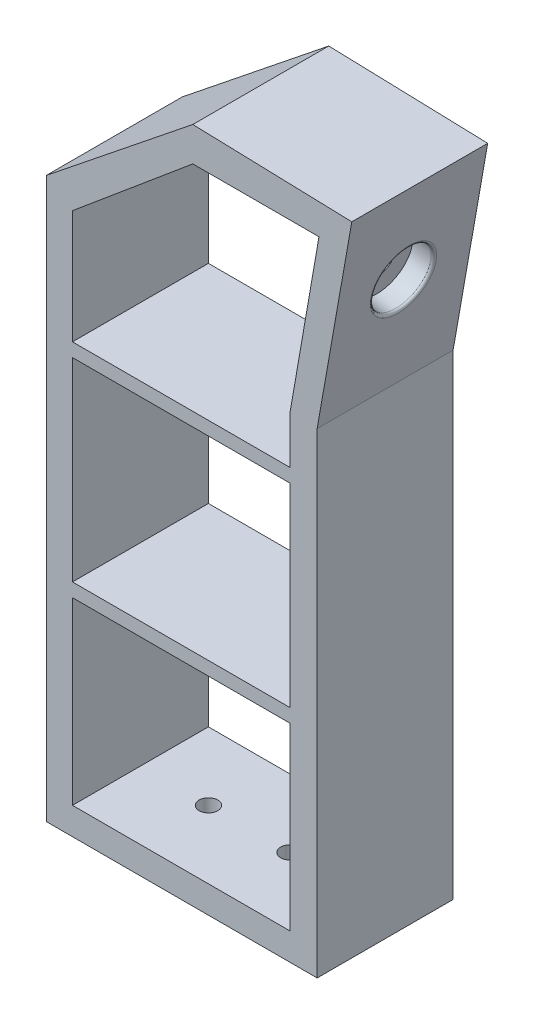
from build123d import *

# Parameters (mm, degrees)
BOSS_EXTRUDE1_DEPTH = 50
SKETCH10_R          = 3.425
CUT_EXTRUDE5_DEPTH  = 10
SKETCH11_W          = 80
SKETCH11_H          = 5
BOSS_EXTRUDE3_DEPTH = 50
SKETCH14_R          = 11.025
CUT_EXTRUDE6_DEPTH  = 8
SKETCH15_R          = 4.05
CUT_EXTRUDE7_DEPTH  = 3
FILLET1_R           = 1


with BuildPart() as part:
    # Sketch2 → Boss-Extrude1 (new body)
    with BuildSketch(Plane.XY):
        Polygon((-40.506485759, 0), (59.130974018, 0), (59.130974018, 175), (71.870010435, 247.246665631), (13.397315769, 249.004598584), (-40.506485759, 205.829132158), align=None)
        Polygon((59.130974018, 232.587704831), (59.8009874, 236.446158122), (42.633663102, 236.446158122), (13.397315769, 236.446158122), (6.25157797, 230.468732297), (-30.869025982, 199.417263157), (-30.869025982, 107.989726368), (-30.869025982, 10), (0, 10), (49.130974018, 10), (49.130974018, 87.5), (49.130974018, 175), align=None, mode=Mode.SUBTRACT)
    extrude(amount=BOSS_EXTRUDE1_DEPTH)

    # Sketch10 → Cut-Extrude5 (cut)
    with BuildSketch(Plane(origin=(0, 10, 0), x_dir=(1, 0, 0), z_dir=(0, 1, 0))):
        with Locations((-5.851287133, -25)):
            Circle(SKETCH10_R)
        with Locations((24.130974018, -25)):
            Circle(SKETCH10_R)
    extrude(amount=-CUT_EXTRUDE5_DEPTH, mode=Mode.SUBTRACT)

    # Sketch11 → Boss-Extrude3 (add)
    with BuildSketch(Plane.XY.offset(50)):
        with Locations((9.130974018, 155.135730726)):
            Rectangle(SKETCH11_W, SKETCH11_H)
        with Locations((9.130974018, 78.651297101)):
            Rectangle(SKETCH11_W, SKETCH11_H)
    extrude(amount=-BOSS_EXTRUDE3_DEPTH)

    # Sketch14 → Cut-Extrude6 (cut)
    with BuildSketch(Plane(origin=(27.42119444, -4.835096423, 0), x_dir=(0, 0, -1), z_dir=(0.9848077530122082, -0.17364817766693028, 0))):
        with Locations((-25, 221.609342659)):
            Circle(SKETCH14_R)
    extrude(amount=-CUT_EXTRUDE6_DEPTH, mode=Mode.SUBTRACT)

    # Sketch15 → Cut-Extrude7 (cut)
    with BuildSketch(Plane(origin=(19.542732416, -3.445911002, 0), x_dir=(0, 0, -1), z_dir=(0.9848077530122081, -0.17364817766693033, 0))):
        with Locations((-25, 221.609342659)):
            Circle(SKETCH15_R)
    extrude(amount=-CUT_EXTRUDE7_DEPTH, mode=Mode.SUBTRACT)

    # Fillet1
    fillet1_edges = [part.edges().sort_by_distance(p)[0] for p in [
        (65.903252947, 213.407502367, 36.025),
    ]]
    fillet(fillet1_edges, radius=FILLET1_R)


solid = part.part
